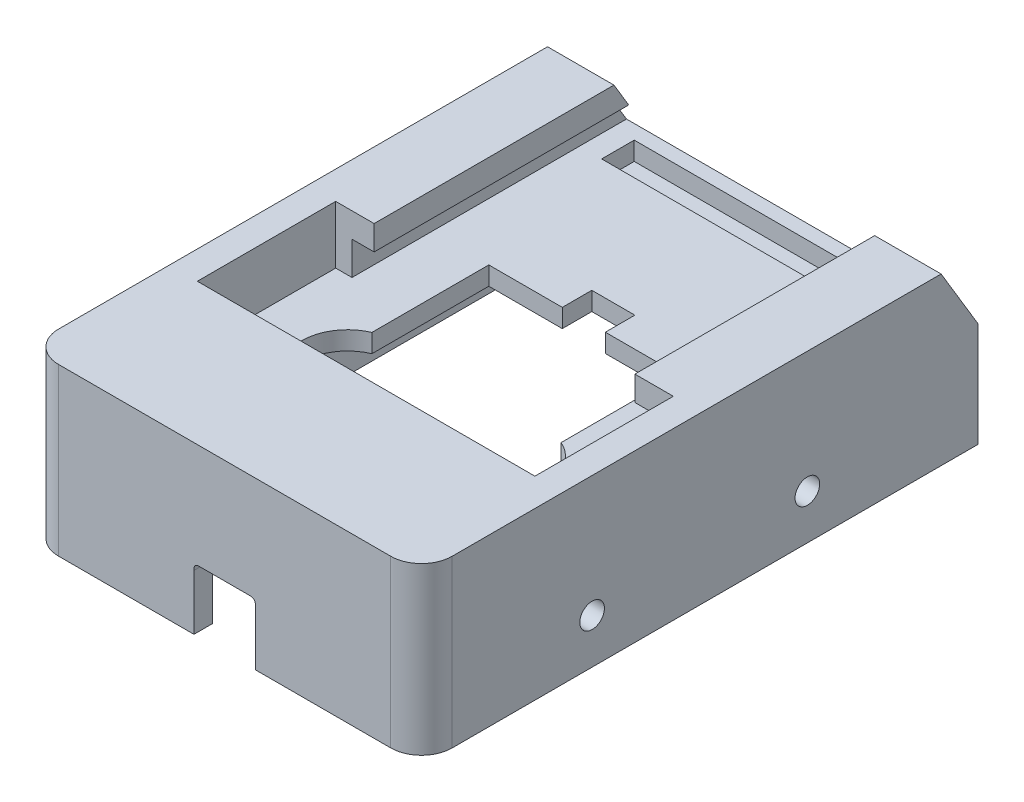
from build123d import *

# Parameters (mm, degrees)
SKETCH1_W           = 64
SKETCH1_H           = 84.5
BOSS_EXTRUDE1_DEPTH = 27
FILLET1_R           = 5
SKETCH2_W           = 42.4
SKETCH2_H           = 61.5
CUT_EXTRUDE1_DEPTH  = 9.4
SKETCH3_W           = 3.6
SKETCH3_H           = 5.4
CUT_EXTRUDE2_DEPTH  = 61.5
SKETCH4_W           = 7
SKETCH4_H           = 4.8
CUT_EXTRUDE3_DEPTH  = 61.5
SKETCH5_W           = 58
SKETCH5_H           = 78.5
CUT_EXTRUDE4_DEPTH  = 14.6
FILLET2_R           = 5
CUT_EXTRUDE5_START  = -9.4
CUT_EXTRUDE5_DEPTH  = 9.4
SKETCH7_W           = 10
SKETCH7_H           = 10
CUT_EXTRUDE6_DEPTH  = 10
FILLET3_SIZE        = 1
SKETCH8_W           = 6.25
SKETCH8_H           = 13.5
CUT_EXTRUDE8_DEPTH  = 9.4
CUT_EXTRUDE9_DEPTH  = 10
SKETCH10_W          = 6.25
SKETCH10_H          = 9
CUT_EXTRUDE10_DEPTH = 9.4
SKETCH11_W          = 7
SKETCH11_H          = 1
SKETCH11_W_2        = 29.4
CUT_EXTRUDE11_DEPTH = 9.4
SKETCH12_W          = 29.4
SKETCH12_H          = 7.5
BOSS_EXTRUDE2_DEPTH = 3
SKETCH13_W          = 0.75
SKETCH13_H          = 27.9
CUT_EXTRUDE12_DEPTH = 3
SKETCH15_R          = 7.369867451
SKETCH15_R_2        = 7.5
CUT_EXTRUDE13_DEPTH = 3
BOSS_EXTRUDE3_DEPTH = 64
BOSS_EXTRUDE4_DEPTH = 27
SKETCH18_W          = 49.6
SKETCH18_H          = 7.565133063
CUT_EXTRUDE16_DEPTH = 5.4
SKETCH19_W          = 42.4
SKETCH19_H          = 4
CUT_EXTRUDE17_DEPTH = 5.4
CUT_EXTRUDE18_DEPTH = 3
SKETCH21_R          = 2
CUT_EXTRUDE19_DEPTH = 10


with BuildPart() as part:
    # Sketch1 → Boss-Extrude1 (new body)
    with BuildSketch(Plane(origin=(0, 0, 0), x_dir=(1, 0, 0), z_dir=(0, 1, 0))):
        with Locations((32, 42.25)):
            Rectangle(SKETCH1_W, SKETCH1_H)
    extrude(amount=BOSS_EXTRUDE1_DEPTH)

    # Fillet1
    fillet1_edges = [part.edges().sort_by_distance(p)[0] for p in [
        (0, 13.5, -84.5),
        (64, 13.5, -84.5),
        (64, 13.5, 0),
        (0, 13.5, 0),
    ]]
    fillet(fillet1_edges, radius=FILLET1_R)

    # Sketch2 → Cut-Extrude1 (cut)
    with BuildSketch(Plane(origin=(0, 27, 0), x_dir=(1, 0, 0), z_dir=(0, 1, 0))):
        with Locations((32, 53.75)):
            Rectangle(SKETCH2_W, SKETCH2_H)
    extrude(amount=-CUT_EXTRUDE1_DEPTH, mode=Mode.SUBTRACT)

    # Sketch3 → Cut-Extrude2 (cut)
    with BuildSketch(Plane(origin=(0, 0, -84.5), x_dir=(-1, 0, 0), z_dir=(0, 0, -1))):
        with Locations((-55, 20.3)):
            Rectangle(SKETCH3_W, SKETCH3_H)
        with Locations((-9, 20.3)):
            Rectangle(SKETCH3_W, SKETCH3_H)
    extrude(amount=-CUT_EXTRUDE2_DEPTH, mode=Mode.SUBTRACT)

    # Sketch4 → Cut-Extrude3 (cut)
    with BuildSketch(Plane(origin=(0, 17.6, 0), x_dir=(1, 0, 0), z_dir=(0, 1, 0))):
        Polygon((17.3, 23), (46.7, 23), (46.7, 49.4), (35.5, 49.4), (28.5, 49.4), (17.3, 49.4), align=None)
        with Locations((32, 51.8)):
            Rectangle(SKETCH4_W, SKETCH4_H)
    extrude(amount=-CUT_EXTRUDE3_DEPTH, mode=Mode.SUBTRACT)

    # Sketch5 → Cut-Extrude4 (cut)
    with BuildSketch(Plane.XZ):
        with Locations((32, -42.25)):
            Rectangle(SKETCH5_W, SKETCH5_H)
        Polygon((28.5, -54.2), (28.5, -49.4), (17.3, -49.4), (17.3, -23), (46.7, -23), (46.7, -49.4), (35.5, -49.4), (35.5, -54.2), align=None, mode=Mode.SUBTRACT)
    extrude(amount=-CUT_EXTRUDE4_DEPTH, mode=Mode.SUBTRACT)

    # Fillet2
    fillet2_edges = [part.edges().sort_by_distance(p)[0] for p in [
        (61, 7.3, -3),
        (61, 7.3, -81.5),
        (3, 7.3, -81.5),
        (3, 7.3, -3),
    ]]
    fillet(fillet2_edges, radius=FILLET2_R)

    # Sketch6 → Cut-Extrude5 (cut)
    with BuildSketch(Plane.XZ.offset(-14.6).offset(CUT_EXTRUDE5_START)):
        with BuildLine():
            Line((8, -3), (56, -3))
            ThreePointArc((56, -3), (59.535533906, -4.464466094), (61, -8))
            Line((61, -8), (61, -20))
            Line((61, -20), (56, -20))
            Line((56, -20), (8, -20))
            Line((8, -20), (3, -20))
            Line((3, -20), (3, -8))
            ThreePointArc((3, -8), (4.464466094, -4.464466094), (8, -3))
        make_face()
    extrude(amount=CUT_EXTRUDE5_DEPTH, mode=Mode.SUBTRACT)

    # Sketch7 → Cut-Extrude6 (cut)
    with BuildSketch(Plane.XY):
        with Locations((32, 5)):
            Rectangle(SKETCH7_W, SKETCH7_H)
    extrude(amount=-CUT_EXTRUDE6_DEPTH, mode=Mode.SUBTRACT)

    # Fillet3
    # a fillet whose section is not a circle: 1 mm, written as the material it adds along each edge
    with BuildSketch(Plane(origin=(37, 10, 0), x_dir=(0, -1, 0), z_dir=(0, 0, -1))) as fillet3_piece_1:
        with BuildLine():
            add(Edge.make_bspline([(FILLET3_SIZE, 0), (FILLET3_SIZE * 0.831801948466, 0), (FILLET3_SIZE * 0.663603896932, 0), (FILLET3_SIZE * 0.292893218813, FILLET3_SIZE * 0.0716919198361), (FILLET3_SIZE * 0.0716919198361, FILLET3_SIZE * 0.292893218813), (0, FILLET3_SIZE * 0.663603896932), (0, FILLET3_SIZE * 0.831801948466), (0, FILLET3_SIZE)], knots=[0, 0, 0, 0, 0, 0, 0.5, 0.5, 1, 1, 1, 1, 1, 1], degree=5))
            Line((0, FILLET3_SIZE), (0, 0))
            Line((0, 0), (FILLET3_SIZE, 0))
        make_face()
    extrude(amount=3)
    with BuildSketch(Plane(origin=(27, 10, 0), x_dir=(0, -1, 0), z_dir=(0, 0, -1))) as fillet3_piece_2:
        with BuildLine():
            add(Edge.make_bspline([(FILLET3_SIZE, 0), (FILLET3_SIZE * 0.831801948466, 0), (FILLET3_SIZE * 0.663603896932, 0), (FILLET3_SIZE * 0.292893218813, -FILLET3_SIZE * 0.0716919198361), (FILLET3_SIZE * 0.0716919198361, -FILLET3_SIZE * 0.292893218813), (0, -FILLET3_SIZE * 0.663603896932), (0, -FILLET3_SIZE * 0.831801948466), (0, -FILLET3_SIZE)], knots=[0, 0, 0, 0, 0, 0, 0.5, 0.5, 1, 1, 1, 1, 1, 1], degree=5))
            Line((0, -FILLET3_SIZE), (0, 0))
            Line((0, 0), (FILLET3_SIZE, 0))
        make_face()
    extrude(amount=3)

    # Sketch8 → Cut-Extrude8 (cut)
    with BuildSketch(Plane(origin=(0, 27, 0), x_dir=(1, 0, 0), z_dir=(0, 1, 0))):
        with Locations((7.675, 29.75)):
            Rectangle(SKETCH8_W, SKETCH8_H)
        with Locations((56.325, 29.75)):
            Rectangle(SKETCH8_W, SKETCH8_H)
    extrude(amount=-CUT_EXTRUDE8_DEPTH, mode=Mode.SUBTRACT)

    # Sketch9 → Cut-Extrude9 (cut)
    with BuildSketch(Plane(origin=(0, 17.6, 0), x_dir=(1, 0, 0), z_dir=(0, 1, 0))):
        Polygon((17.3, 49.4), (17.3, 57.4), (28.5, 57.4), (28.5, 62.2), (35.5, 62.2), (35.5, 57.4), (46.7, 57.4), (46.7, 49.4), align=None)
    extrude(amount=-CUT_EXTRUDE9_DEPTH, mode=Mode.SUBTRACT)

    # Sketch10 → Cut-Extrude10 (cut)
    with BuildSketch(Plane(origin=(0, 27, 0), x_dir=(1, 0, 0), z_dir=(0, 1, 0))):
        with Locations((7.675, 41)):
            Rectangle(SKETCH10_W, SKETCH10_H)
        with Locations((56.325, 41)):
            Rectangle(SKETCH10_W, SKETCH10_H)
    extrude(amount=-CUT_EXTRUDE10_DEPTH, mode=Mode.SUBTRACT)

    # Sketch11 → Cut-Extrude11 (cut)
    with BuildSketch(Plane(origin=(0, 17.6, 0), x_dir=(1, 0, 0), z_dir=(0, 1, 0))):
        with Locations((32, 62.7)):
            Rectangle(SKETCH11_W, SKETCH11_H)
        with Locations((32, 57.9)):
            Rectangle(SKETCH11_W_2, SKETCH11_H)
    extrude(amount=-CUT_EXTRUDE11_DEPTH, mode=Mode.SUBTRACT)

    # Sketch12 → Boss-Extrude2 (add)
    with BuildSketch(Plane.XZ.offset(-14.6)):
        with Locations((32, -26.75)):
            Rectangle(SKETCH12_W, SKETCH12_H)
    extrude(amount=-BOSS_EXTRUDE2_DEPTH)

    # Sketch13 → Cut-Extrude12 (cut)
    with BuildSketch(Plane(origin=(0, 17.6, 0), x_dir=(1, 0, 0), z_dir=(0, 1, 0))):
        with Locations((16.925, 44.45)):
            Rectangle(SKETCH13_W, SKETCH13_H)
        with Locations((47.075, 44.45)):
            Rectangle(SKETCH13_W, SKETCH13_H)
    extrude(amount=-CUT_EXTRUDE12_DEPTH, mode=Mode.SUBTRACT)

    # Sketch15 → Cut-Extrude13 (cut)
    with BuildSketch(Plane.XZ.offset(-14.6)):
        with Locations((44.5, -32.5)):
            Circle(SKETCH15_R)
        with Locations((19.5, -32.5)):
            Circle(SKETCH15_R_2)
    extrude(amount=-CUT_EXTRUDE13_DEPTH, mode=Mode.SUBTRACT)

    # Sketch16 → Boss-Extrude3 (add)
    with BuildSketch(Plane(origin=(64, 0, 0), x_dir=(0, 0, -1), z_dir=(1, 0, 0))):
        Polygon((84.5, 27), (84.5, 17), (84.5, 0), (90.5, 0), (90.5, 17), align=None)
    extrude(amount=-BOSS_EXTRUDE3_DEPTH)

    # Sketch17 → Boss-Extrude4 (add)
    with BuildSketch(Plane(origin=(0, 27, 0), x_dir=(1, 0, 0), z_dir=(0, 1, 0))):
        Polygon((64, 84.5), (64, 79.5), (59, 84.5), align=None)
        Polygon((0, 79.5), (5, 84.5), (0, 84.5), align=None)
    extrude(amount=-BOSS_EXTRUDE4_DEPTH)

    # Sketch18 → Cut-Extrude16 (cut)
    with BuildSketch(Plane(origin=(0, 17.6, 0), x_dir=(1, 0, 0), z_dir=(0, 1, 0))):
        with Locations((32, 88.282566532)):
            Rectangle(SKETCH18_W, SKETCH18_H)
    extrude(amount=CUT_EXTRUDE16_DEPTH, mode=Mode.SUBTRACT)

    # Sketch19 → Cut-Extrude17 (cut)
    with BuildSketch(Plane.XY.offset(-84.5)):
        with Locations((32, 25)):
            Rectangle(SKETCH19_W, SKETCH19_H)
    extrude(amount=-CUT_EXTRUDE17_DEPTH, mode=Mode.SUBTRACT)

    # Sketch20 → Cut-Extrude18 (cut)
    with BuildSketch(Plane(origin=(0, 17.6, 0), x_dir=(1, 0, 0), z_dir=(0, 1, 0))):
        Polygon((10.8, 84.5), (10.8, 87.8), (53.2, 87.8), (53.2, 84.5), (53.2, 82.5), (10.8, 82.5), align=None)
    extrude(amount=-CUT_EXTRUDE18_DEPTH, mode=Mode.SUBTRACT)

    # Sketch21 → Cut-Extrude19 (cut)
    with BuildSketch(Plane.ZY.offset(-61)):
        with Locations((-62.75, 7.3)):
            Circle(SKETCH21_R)
        with Locations((-27.75, 7.3)):
            Circle(SKETCH21_R)
    extrude(amount=-CUT_EXTRUDE19_DEPTH, mode=Mode.SUBTRACT)


solid = part.part
